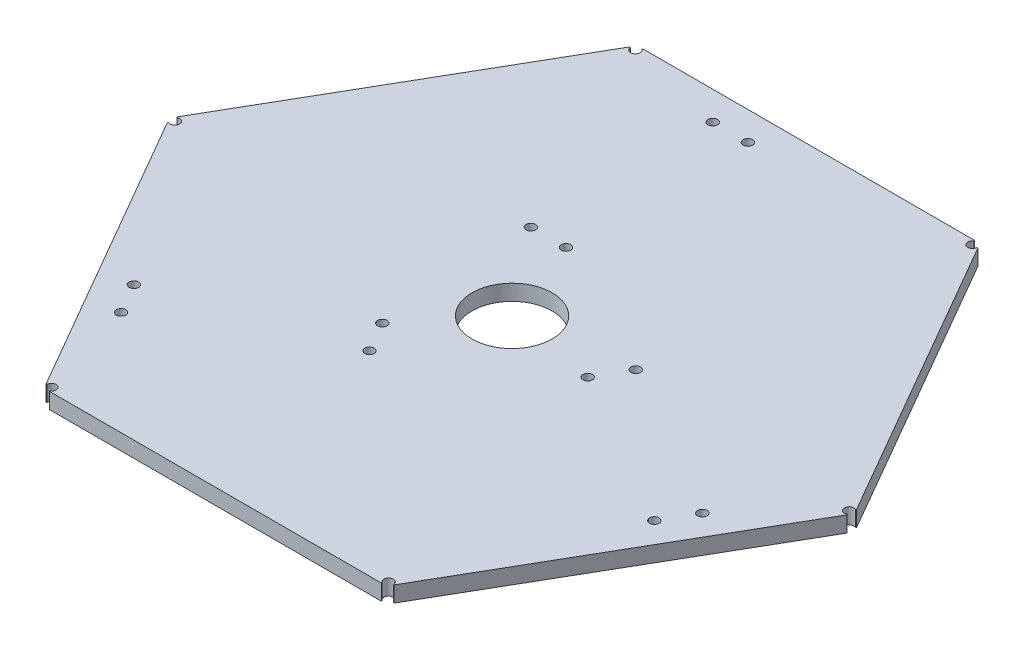
from build123d import *

# Parameters (mm, degrees)
BOSS_EXTRUDE1_DEPTH = 5
CUT_EXTRUDE3_DEPTH  = 144.674400411
SKETCH7_R           = 1.5
CUT_EXTRUDE5_DEPTH  = 144.674400411
CIRPATTERN3_DEPTH   = 5
CUT_EXTRUDE6_REACH  = 145.04
SKETCH9_R           = 12.7
SKETCH10_R          = 1.5
CUT_EXTRUDE7_DEPTH  = 144.040070255


# Read off the part's stored shape, not the designer's step: CirPattern3
with BuildPart() as part:
    # Sketch1 → Boss-Extrude1 (new body)
    with BuildSketch(Plane(origin=(0, 0, 0), x_dir=(1, 0, 0), z_dir=(0, 1, 0))):
        Polygon((54.270925304, 94), (-54.270925304, 94), (-108.541850608, 0), (-54.270925304, -94), (54.270925304, -94), (108.541850608, 0), align=None)
    extrude(amount=BOSS_EXTRUDE1_DEPTH)

    # Sketch6 → Cut-Extrude3 (cut, through all)
    with BuildSketch(Plane(origin=(0, 5, 0), x_dir=(1, 0, 0), z_dir=(0, 1, 0))):
        Polygon((-52.550395529, 93.006651671), (-52.550395529, 94.993348329), (-54.270925304, 95.986696658), (-55.991455079, 94.993348329), (-55.991455079, 93.006651671), (-54.270925304, 92.013303342), align=None)
    extrude(amount=-CUT_EXTRUDE3_DEPTH, mode=Mode.SUBTRACT)

    # Sketch7 → Cut-Extrude5 (cut, through all)
    with BuildSketch(Plane(origin=(0, 5, 0), x_dir=(1, 0, 0), z_dir=(0, 1, 0))):
        with Locations((-53.4048999, 92.5)):
            Circle(SKETCH7_R)
    extrude(amount=-CUT_EXTRUDE5_DEPTH, mode=Mode.SUBTRACT)

    # CirPattern3 outline → CirPattern3 (cut)
    with BuildSketch(Plane(origin=(0, 0, 0), x_dir=(1, 0, 0), z_dir=(0, 1, 0))):
        with BuildLine():
            ThreePointArc((107.490156817, 1.335134155), (105.331435102, -0.002284917), (107.471793734, -1.368899034))
            Line((107.471793734, -1.368899034), (107.68158572, -1.490022493))
            Line((107.68158572, -1.490022493), (108.541850608, 0))
            Line((108.541850608, 0), (107.700797112, 1.456747386))
            Line((107.700797112, 1.456747386), (107.490156817, 1.335134155))
        make_face()
        with BuildLine():
            Line((54.913619301, 92.369573958), (55.137593989, 92.498885804))
            Line((55.137593989, 92.498885804), (54.270925304, 94))
            Line((54.270925304, 94), (52.576010718, 94))
            Line((52.576010718, 94), (52.576010718, 93.740508989))
            ThreePointArc((52.576010718, 93.740508989), (52.660468715, 91.206101044), (54.913619301, 92.369573958))
        make_face()
        with BuildLine():
            Line((-108.541850608, 0), (-107.675181923, -1.501114196))
            Line((-107.675181923, -1.501114196), (-107.451207235, -1.37180235))
            ThreePointArc((-107.451207235, -1.37180235), (-105.317034842, -0.002253161), (-107.469667507, 1.338093583))
            Line((-107.469667507, 1.338093583), (-107.694393315, 1.467839088))
            Line((-107.694393315, 1.467839088), (-108.541850608, 0))
        make_face()
        with BuildLine():
            Line((-54.270925304, -94), (-52.550395529, -94))
            Line((-52.550395529, -94), (-52.550395529, -93.757753081))
            ThreePointArc((-52.550395529, -93.757753081), (-52.663738755, -91.220841074), (-54.901338504, -92.421639383))
            Line((-54.901338504, -92.421639383), (-55.111978799, -92.543252614))
            Line((-55.111978799, -92.543252614), (-54.270925304, -94))
        make_face()
        with BuildLine():
            Line((54.270925304, -94), (55.118382597, -92.532160912))
            Line((55.118382597, -92.532160912), (54.915257504, -92.414886585))
            ThreePointArc((54.915257504, -92.414886585), (52.669300376, -91.225904252), (52.576010718, -93.765451347))
            Line((52.576010718, -93.765451347), (52.576010718, -94))
            Line((52.576010718, -94), (54.270925304, -94))
        make_face()
    extrude(amount=CIRPATTERN3_DEPTH, mode=Mode.SUBTRACT)

    # Sketch9 → Cut-Extrude6 (cut, up to next)
    with BuildSketch(Plane(origin=(0, 5, 0), x_dir=(1, 0, 0), z_dir=(0, 1, 0)), mode=Mode.PRIVATE) as cut_extrude6_sk1:
        with Locations(Location((0, 0, 0), (0, 0, 270))):
            Circle(SKETCH9_R)
    cut_extrude6_tool1 = extrude(cut_extrude6_sk1.sketch, amount=-CUT_EXTRUDE6_REACH, mode=Mode.PRIVATE) & part.part
    add(cut_extrude6_tool1.solids().sort_by_distance((0, 5, 0))[0], mode=Mode.SUBTRACT)

    # Sketch10 → Cut-Extrude7 (cut, through all)
    with BuildSketch(Plane(origin=(0, 5, 0), x_dir=(1, 0, 0), z_dir=(0, 1, 0))):
        with Locations(Location((-68.463084387, -51.348426962, 0), (0, 0, 270))):
            Circle(SKETCH10_R)
        with Locations(Location((-10.2375, 84.964983782, 0), (0, 0, 270))):
            Circle(SKETCH10_R)
        with Locations(Location((-21.3625, 27.339983782, 0), (0, 0, 270))):
            Circle(SKETCH10_R)
        with Locations(Location((-10.2375, 27.339983782, 0), (0, 0, 270))):
            Circle(SKETCH10_R)
        with Locations(Location((-21.3625, 84.964983782, 0), (0, 0, 270))):
            Circle(SKETCH10_R)
        with Locations(Location((28.795870494, -4.80405682, 0), (0, 0, 270))):
            Circle(SKETCH10_R)
        with Locations(Location((34.358370494, 4.830475797, 0), (0, 0, 270))):
            Circle(SKETCH10_R)
        with Locations(Location((84.263084387, -23.982024203, 0), (0, 0, 270))):
            Circle(SKETCH10_R)
        with Locations(Location((78.700584387, -33.61655682, 0), (0, 0, 270))):
            Circle(SKETCH10_R)
        with Locations(Location((-12.995870494, -32.170459579, 0), (0, 0, 270))):
            Circle(SKETCH10_R)
        with Locations(Location((-18.558370494, -22.535926962, 0), (0, 0, 270))):
            Circle(SKETCH10_R)
        with Locations(Location((-62.900584387, -60.982959579, 0), (0, 0, 270))):
            Circle(SKETCH10_R)
    extrude(amount=-CUT_EXTRUDE7_DEPTH, mode=Mode.SUBTRACT)


solid = part.part
